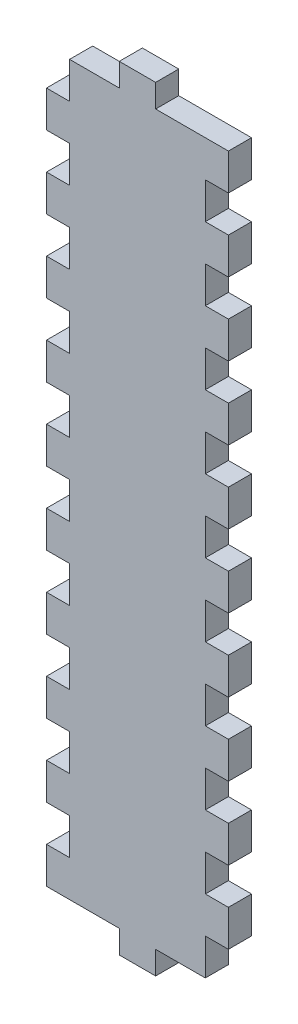
from build123d import *

# Parameters (mm, degrees)
SKETCH1_W           = 37.3
SKETCH1_H           = 200
BOSS_EXTRUDE1_DEPTH = 6.35
SKETCH10_W          = 6.35
SKETCH10_H          = 10
BOSS_EXTRUDE3_DEPTH = 6.35
SKETCH11_W          = 6.35
SKETCH11_H          = 10
BOSS_EXTRUDE4_DEPTH = 6.35
LPATTERN5_COUNT     = 10
LPATTERN5_PITCH     = 20
SKETCH12_W          = 10
SKETCH12_H          = 6.35
BOSS_EXTRUDE5_DEPTH = 6.35


with BuildPart() as part:
    # Sketch1 → Boss-Extrude1 (new body)
    with BuildSketch(Plane.XY):
        Rectangle(SKETCH1_W, SKETCH1_H)
    extrude(amount=BOSS_EXTRUDE1_DEPTH)

    # Sketch10 → Boss-Extrude3 (add)
    with BuildSketch(Plane.XY):
        with Locations((-21.825, -95)):
            Rectangle(SKETCH10_W, SKETCH10_H)
    boss_extrude3 = extrude(amount=BOSS_EXTRUDE3_DEPTH)

    # Sketch11 → Boss-Extrude4 (add)
    with BuildSketch(Plane.XY):
        with Locations((21.825, -85)):
            Rectangle(SKETCH11_W, SKETCH11_H)
    boss_extrude4 = extrude(amount=BOSS_EXTRUDE4_DEPTH)

    # LPattern5: Boss-Extrude3, Boss-Extrude4 ×10
    with Locations(*[(0, i * LPATTERN5_PITCH, 0) for i in range(1, LPATTERN5_COUNT)]):
        add(boss_extrude3)
        add(boss_extrude4)

    # Sketch12 → Boss-Extrude5 (add)
    with BuildSketch(Plane.XY):
        with Locations((0, 103.175)):
            Rectangle(SKETCH12_W, SKETCH12_H)
    boss_extrude5 = extrude(amount=BOSS_EXTRUDE5_DEPTH)

    # Mirror1: Boss-Extrude5 across plane
    add(boss_extrude5.mirror(Plane.ZX))


solid = part.part
